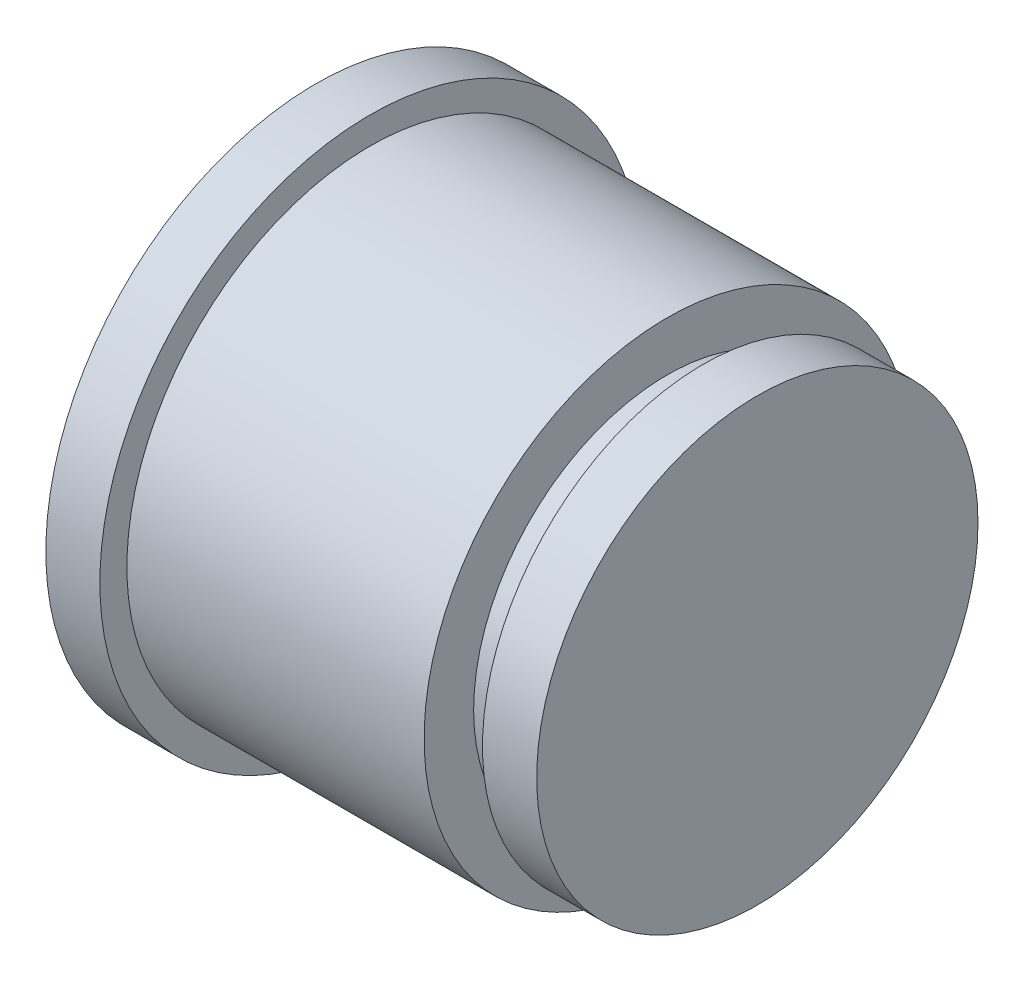
from build123d import *

# Parameters (mm, degrees)
SKETCH1_R        = 30
BIGLIP_DEPTH     = 6
SKETCH2_R        = 27
INNERTUBE_DEPTH  = 33
SKETCH3_R        = 21.5
CONNECTION_DEPTH = 4
SKETCH4_R        = 24.5
SMALLLIP_DEPTH   = 6
CHAMFER1_SIZE    = 3.119205001
CHAMFER1_SIZE_2  = 0.55


with BuildPart() as part:
    # Sketch1 → bigLip (new body)
    with BuildSketch(Plane(origin=(0, 0, 0), x_dir=(0, 0, -1), z_dir=(1, 0, 0))):
        Circle(SKETCH1_R)
    extrude(amount=BIGLIP_DEPTH)

    # Sketch2 → innerTube (add)
    with BuildSketch(Plane(origin=(6, 0, 0), x_dir=(0, 0, -1), z_dir=(1, 0, 0))):
        Circle(SKETCH2_R)
    extrude(amount=INNERTUBE_DEPTH)

    # Sketch3 → connection (add)
    with BuildSketch(Plane(origin=(39, 0, 0), x_dir=(0, 0, -1), z_dir=(1, 0, 0))):
        Circle(SKETCH3_R)
    extrude(amount=CONNECTION_DEPTH)

    # Sketch4 → smallLip (add)
    with BuildSketch(Plane(origin=(43, 0, 0), x_dir=(0, 0, -1), z_dir=(1, 0, 0))):
        Circle(SKETCH4_R)
    extrude(amount=SMALLLIP_DEPTH)

    # Chamfer1
    # the kernel refuses this chamfer: 3.119205001, 0.55 mm, written as the material it adds along each edge
    with BuildSketch(Plane(origin=(43, 0, 0), x_dir=(0, 0, -1), z_dir=(0, -1, 0))) as chamfer1_piece_1_section:
        Polygon((21.5 + CHAMFER1_SIZE, 0), (21.5, -CHAMFER1_SIZE_2), (21.5, 0), align=None)
    chamfer1_piece_1 = revolve(axis=Axis((43, 0, 0), (1, 0, 0)), mode=Mode.PRIVATE)
    chamfer1_piece_1 = chamfer1_piece_1 & Plane(origin=(42.756656471, 0, 0), x_dir=(0, 0, -1), z_dir=(-1, 0, 0)) * Cylinder(24.5, 99, mode=Mode.PRIVATE)
    add(chamfer1_piece_1)


solid = part.part
